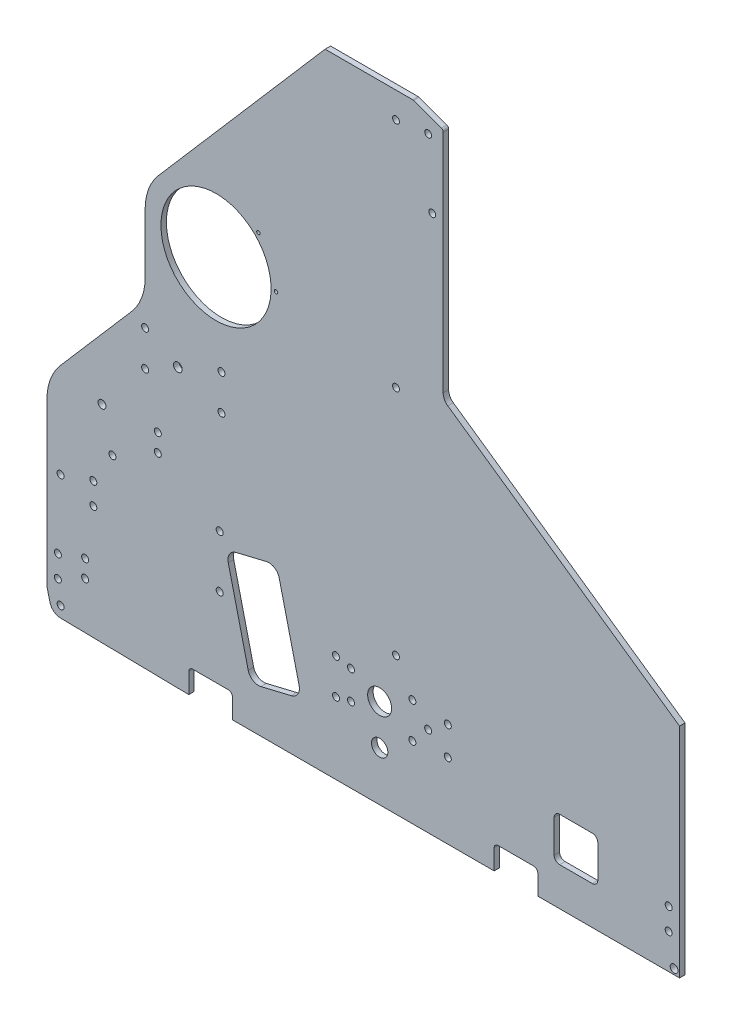
from build123d import *

# Parameters (mm, degrees)
SKETCH1_R           = 2.032
SKETCH1_R_2         = 2.54
SKETCH1_R_3         = 2
BOSS_EXTRUDE1_DEPTH = 3.175
FILLET1_R           = 2.286
FILLET2_R           = 6.35
SKETCH2_R           = 2.032
CUT_EXTRUDE1_DEPTH  = 505.524983177
FILLET3_R           = 1.5875
SKETCH3_R           = 2.032
SKETCH3_R_2         = 2.286
SKETCH3_R_3         = 1.016
CUT_EXTRUDE2_DEPTH  = 505.524983177
SKETCH4_R           = 2.032
SKETCH4_R_2         = 6.985
SKETCH4_R_3         = 4.7625
CUT_EXTRUDE3_DEPTH  = 505.524983177
SKETCH5_R           = 32.0675
SKETCH5_R_2         = 2.286
CUT_EXTRUDE5_DEPTH  = 540.282512071
FILLET4_R           = 31.75
CUT_EXTRUDE6_DEPTH  = 505.524983177


with BuildPart() as part:
    # Sketch1 → Boss-Extrude1 (new body)
    with BuildSketch(Plane.XY):
        with BuildLine():
            Line((7.829508682, -19.049081656), (82.55, -20.32))
            Line((82.55, -20.32), (82.55, -6.35))
            Line((82.55, -6.35), (107.95, -6.35))
            Line((107.95, -6.35), (107.95, -20.32))
            Line((107.95, -20.32), (260.35, -20.32))
            Line((260.35, -20.32), (260.35, -6.35))
            Line((260.35, -6.35), (285.75, -6.35))
            Line((285.75, -6.35), (285.75, -20.32))
            Line((285.75, -20.32), (368.3, -20.32))
            Line((368.3, -20.32), (368.3, 106.68))
            Line((368.3, 106.68), (230.66375, 202.565))
            Line((230.66375, 202.565), (230.66375, 338.455))
            Line((230.66375, 338.455), (213.19998, 344.805))
            Line((213.19998, 344.805), (203.2, 344.805))
            Line((203.2, 344.805), (161.925, 344.805))
            Line((161.925, 344.805), (52.720122664, 218.469945827))
            ThreePointArc((52.720122664, 218.469945827), (52.803835479, 218.142145922), (52.832, 217.805))
            ThreePointArc((52.832, 217.805), (52.095493096, 216.239521914), (50.419872403, 215.808871996))
            Line((50.419872403, 215.808871996), (0, 157.48))
            Line((0, 157.48), (0, 0))
            Line((0, 0), (0, -6.35))
            ThreePointArc((0, -6.35), (0.047577015, -7.125863724), (0.189595124, -7.890101219))
            Line((0.189595124, -7.890101219), (1.777095124, -14.240101219))
            ThreePointArc((1.777095124, -14.240101219), (3.987212552, -17.671692778), (7.829508682, -19.049081656))
        make_face()
        with Locations((7.9375, -12.7)):
            Circle(SKETCH1_R, mode=Mode.SUBTRACT)
        with Locations((6.35, 0)):
            Circle(SKETCH1_R, mode=Mode.SUBTRACT)
        with Locations((6.35, 12.7)):
            Circle(SKETCH1_R, mode=Mode.SUBTRACT)
        with Locations((38.1, 78.105)):
            Circle(SKETCH1_R, mode=Mode.SUBTRACT)
        with Locations((57.15, 131.28625)):
            Circle(SKETCH1_R, mode=Mode.SUBTRACT)
        with Locations((57.15, 151.92375)):
            Circle(SKETCH1_R, mode=Mode.SUBTRACT)
        with Locations((76.2, 141.605)):
            Circle(SKETCH1_R_2, mode=Mode.SUBTRACT)
        with Locations((101.6, 131.28625)):
            Circle(SKETCH1_R, mode=Mode.SUBTRACT)
        with Locations((101.6, 151.92375)):
            Circle(SKETCH1_R, mode=Mode.SUBTRACT)
        with Locations((203.2, 59.805)):
            Circle(SKETCH1_R_3, mode=Mode.SUBTRACT)
        with Locations((361.95, 0)):
            Circle(SKETCH1_R, mode=Mode.SUBTRACT)
        with Locations((361.95, 12.7)):
            Circle(SKETCH1_R, mode=Mode.SUBTRACT)
        with Locations((76.2, 217.805)):
            Circle(SKETCH1_R, mode=Mode.SUBTRACT)
        with Locations((203.2, 194.805)):
            Circle(SKETCH1_R_3, mode=Mode.SUBTRACT)
        with Locations((224.31375, 293.243)):
            Circle(SKETCH1_R, mode=Mode.SUBTRACT)
        with Locations((203.2, 329.805)):
            Circle(SKETCH1_R_3, mode=Mode.SUBTRACT)
        with Locations((221.931865, 332.105)):
            Circle(SKETCH1_R_3, mode=Mode.SUBTRACT)
    extrude(amount=BOSS_EXTRUDE1_DEPTH)

    # Fillet1
    fillet1_edges = [part.edges().sort_by_distance(p)[0] for p in [
        (285.75, -6.35, 1.5875),
        (107.95, -6.35, 1.5875),
        (260.35, -6.35, 1.5875),
        (82.55, -6.35, 1.5875),
    ]]
    fillet(fillet1_edges, radius=FILLET1_R)

    # Fillet2
    fillet2_edges = [part.edges().sort_by_distance(p)[0] for p in [
        (230.66375, 202.565, 1.5875),
    ]]
    fillet(fillet2_edges, radius=FILLET2_R)

    # Sketch2 → Cut-Extrude1 (cut, through all)
    with BuildSketch(Plane(origin=(0, 0, 0), x_dir=(-1, 0, 0), z_dir=(0, 0, -1))):
        with Locations((-100.552770272, 71.086035298)):
            Circle(SKETCH2_R)
        with Locations((-100.552770272, 40.606035298)):
            Circle(SKETCH2_R)
        with Locations((-22.225, 18.202541089)):
            Circle(SKETCH2_R)
        with Locations((-22.225, 8.042541089)):
            Circle(SKETCH2_R)
    extrude(amount=-CUT_EXTRUDE1_DEPTH, mode=Mode.SUBTRACT)

    # Fillet3
    fillet3_edges = [part.edges().sort_by_distance(p)[0] for p in [
        (230.66375, 338.455, 1.5875),
        (213.19998, 344.805, 1.5875),
    ]]
    fillet(fillet3_edges, radius=FILLET3_R)

    # Sketch3 → Cut-Extrude2 (cut, through all)
    with BuildSketch(Plane.XY.offset(3.175)):
        with BuildLine():
            Line((127.789357836, 69.359781229), (110.090757964, 65.117192092))
            ThreePointArc((110.090757964, 65.117192092), (106.28794748, 62.356296076), (105.551202695, 57.715054701))
            Line((105.551202695, 57.715054701), (117.160045499, 9.28701769))
            ThreePointArc((117.160045499, 9.28701769), (119.920941515, 5.484207206), (124.56218289, 4.74746242))
            Line((124.56218289, 4.74746242), (142.260782762, 8.990051558))
            ThreePointArc((142.260782762, 8.990051558), (146.063593246, 11.750947574), (146.800338031, 16.392188949))
            Line((146.800338031, 16.392188949), (135.191495227, 64.82022596))
            ThreePointArc((135.191495227, 64.82022596), (132.430599211, 68.623036444), (127.789357836, 69.359781229))
        make_face()
        with Locations((26.987500002, 46.953113935)):
            Circle(SKETCH3_R)
        with Locations((26.987500002, 59.653113935)):
            Circle(SKETCH3_R)
        with Locations((7.937500002, 53.303113935)):
            Circle(SKETCH3_R)
        with Locations((32.03059934, 100.810872615)):
            Circle(SKETCH3_R_2)
        with Locations((64.525942114, 102.94048958)):
            Circle(SKETCH3_R)
        with Locations((64.525942114, 92.525786339)):
            Circle(SKETCH3_R)
        with Locations((133.35, 208.228121768)):
            Circle(SKETCH3_R_3)
        with Locations((123.120704333, 232.923826101)):
            Circle(SKETCH3_R_3)
    extrude(amount=-CUT_EXTRUDE2_DEPTH, mode=Mode.SUBTRACT)

    # Sketch4 → Cut-Extrude3 (cut, through all)
    with BuildSketch(Plane.XY.offset(3.175)):
        with Locations((168.275, 42.06875)):
            Circle(SKETCH4_R)
        with Locations((212.725, 42.06875)):
            Circle(SKETCH4_R)
        with Locations((212.725, 21.43125)):
            Circle(SKETCH4_R)
        with Locations((168.275, 21.43125)):
            Circle(SKETCH4_R)
        with Locations((193.675, 31.75)):
            Circle(SKETCH4_R_2)
        with Locations((177.00498, 40.0431)):
            Circle(SKETCH4_R)
        with Locations((177.00498, 23.4569)):
            Circle(SKETCH4_R)
        with Locations((193.675, 8.466666658)):
            Circle(SKETCH4_R_3)
        with Locations((221.931865, 31.75)):
            Circle(SKETCH4_R)
        with Locations((233.36123, 23.4569)):
            Circle(SKETCH4_R)
        with Locations((233.36123, 40.0431)):
            Circle(SKETCH4_R)
    extrude(amount=-CUT_EXTRUDE3_DEPTH, mode=Mode.SUBTRACT)

    # Sketch5 → Cut-Extrude5 (cut, through all)
    with BuildSketch(Plane(origin=(0, 0, -187.324999476), x_dir=(-1, 0, 0), z_dir=(0, 0, -1))):
        Polygon((0, 157.48), (-57.15, 223.594705882), (-57.15, 165.333696112), (0, 99.218990229), align=None)
        with Locations((-98.425, 208.228121768)):
            Circle(SKETCH5_R)
        with Locations((-365.124999998, -17.144978643)):
            Circle(SKETCH5_R_2)
    extrude(amount=-CUT_EXTRUDE5_DEPTH, mode=Mode.SUBTRACT)

    # Fillet4
    fillet4_edges = [part.edges().sort_by_distance(p)[0] for p in [
        (0, 99.218990229, 1.5875),
        (57.15, 165.333696112, 1.5875),
        (57.15, 223.594705882, 1.5875),
    ]]
    fillet(fillet4_edges, radius=FILLET4_R)

    # Sketch6 → Cut-Extrude6 (cut, through all)
    with BuildSketch(Plane.XY.offset(3.175)):
        with BuildLine():
            Line((298.45, 27.305), (317.5, 27.305))
            ThreePointArc((317.5, 27.305), (319.74506403, 26.37506403), (320.675, 24.13))
            Line((320.675, 24.13), (320.675, 5.08))
            ThreePointArc((320.675, 5.08), (319.74506403, 2.83493597), (317.5, 1.905))
            Line((317.5, 1.905), (298.45, 1.905))
            ThreePointArc((298.45, 1.905), (296.20493597, 2.83493597), (295.275, 5.08))
            Line((295.275, 5.08), (295.275, 24.13))
            ThreePointArc((295.275, 24.13), (296.20493597, 26.37506403), (298.45, 27.305))
        make_face()
    extrude(amount=-CUT_EXTRUDE6_DEPTH, mode=Mode.SUBTRACT)


solid = part.part
